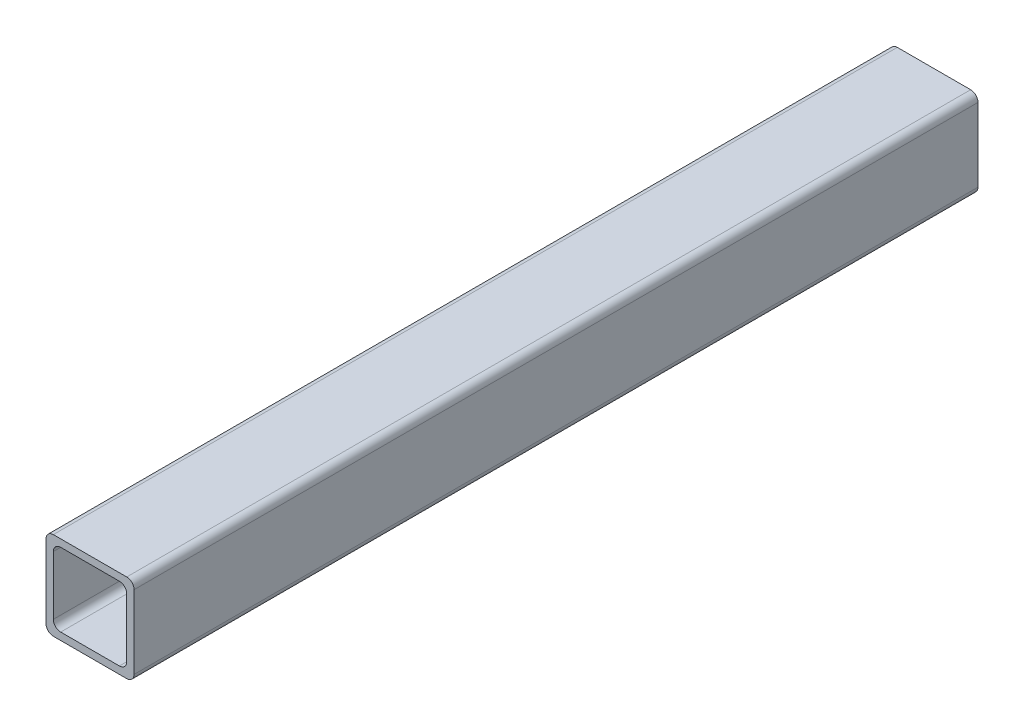
from build123d import *

# Parameters (mm, degrees)
BOSS_EXTRUDE1_DEPTH = 575
SKETCH2_R           = 8.5
CUT_EXTRUDE1_DEPTH  = 10


with BuildPart() as part:
    # Sketch1 → Boss-Extrude1 (new, symmetric)
    with BuildSketch(Plane.XY):
        with BuildLine():
            Line((-50, -60), (50, -60))
            ThreePointArc((50, -60), (57.071067812, -57.071067812), (60, -50))
            Line((60, -50), (60, 50))
            ThreePointArc((60, 50), (57.071067812, 57.071067812), (50, 60))
            Line((50, 60), (-50, 60))
            ThreePointArc((-50, 60), (-57.071067812, 57.071067812), (-60, 50))
            Line((-60, 50), (-60, -50))
            ThreePointArc((-60, -50), (-57.071067812, -57.071067812), (-50, -60))
        make_face()
        with BuildLine():
            Line((-40, -50), (40, -50))
            ThreePointArc((40, -50), (47.071067812, -47.071067812), (50, -40))
            Line((50, -40), (50, 40))
            ThreePointArc((50, 40), (47.071067812, 47.071067812), (40, 50))
            Line((40, 50), (-40, 50))
            ThreePointArc((-40, 50), (-47.071067812, 47.071067812), (-50, 40))
            Line((-50, 40), (-50, -40))
            ThreePointArc((-50, -40), (-47.071067812, -47.071067812), (-40, -50))
        make_face(mode=Mode.SUBTRACT)
    extrude(amount=BOSS_EXTRUDE1_DEPTH, both=True)

    # Sketch2 → Cut-Extrude1 (cut)
    with BuildSketch(Plane.XZ.offset(60)):
        with Locations((0, 498.5)):
            Circle(SKETCH2_R)
        with Locations((0, -498.5)):
            Circle(SKETCH2_R)
    extrude(amount=-CUT_EXTRUDE1_DEPTH, mode=Mode.SUBTRACT)


solid = part.part
